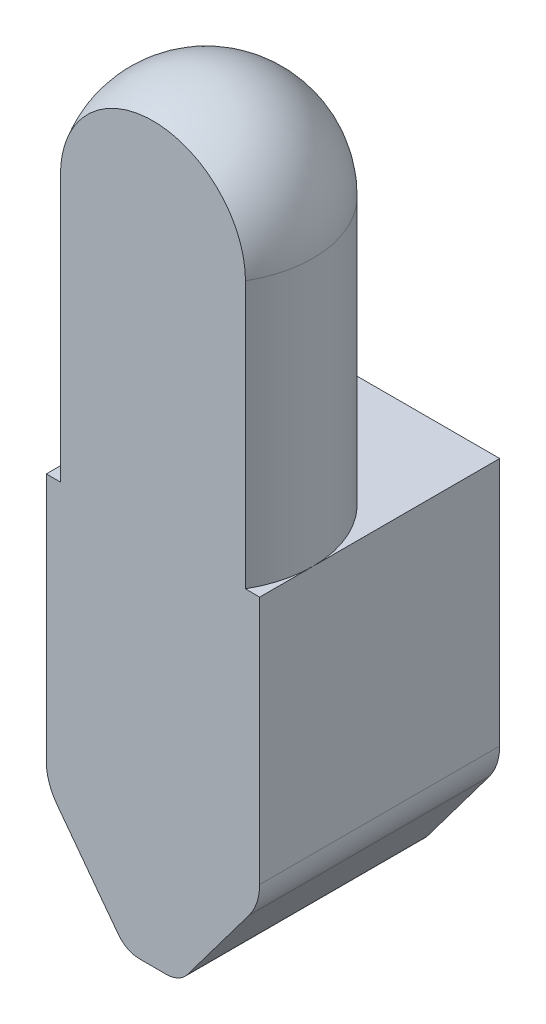
from build123d import *

# Parameters (mm, degrees)
EXTRUDE_1_DEPTH          = 4.5
EXTRUDE_2_DEPTH          = 5
CUT_EXTRUDE_1_DEPTH      = 13.971121771
CUT_EXTRUDE_1_DEPTH_BACK = 13.971121771
SKETCH_4_W               = 4.107505073
SKETCH_4_H               = 2.274071006
FILLET_1_R               = 1
FILLET_2_R               = 0.5


with BuildPart() as part:
    # Эскиз1 → Бобышка-Вытянуть1 (new body)
    with BuildSketch(Plane.XY):
        Polygon((2, 0), (2, 5), (-2, 5), (-2, 0), (-0.5, -2), (0.5, -2), align=None)
    extrude(amount=-EXTRUDE_1_DEPTH)

    # Эскиз2 → Бобышка-Вытянуть2 (add)
    with BuildSketch(Plane(origin=(0, 5, 0), x_dir=(1, 0, 0), z_dir=(0, 1, 0))):
        with BuildLine():
            Line((-1.732050808, 0), (1.732050808, 0))
            ThreePointArc((1.732050808, 0), (0, 3), (-1.732050808, 0))
        make_face()
    extrude(amount=EXTRUDE_2_DEPTH)

    # Эскиз3 → Повернуть1 (revolve)
    with BuildSketch(Plane(origin=(0, 10, 0), x_dir=(1, 0, 0), z_dir=(0, 1, 0))):
        with BuildLine():
            ThreePointArc((2, 1), (0, 3), (-2, 1))
            Line((-2, 1), (2, 1))
        make_face()
    revolve(axis=Axis((-2, 10, -1), (1, 0, 0)))

    # Эскиз4 → Вырез-Вытянуть1 (cut, two sides: drawn at the far end of the back side and taken through both)
    with BuildSketch(Plane(origin=(0, 0, 0), x_dir=(1, 0, 0), z_dir=(0, 1, 0)).offset(-CUT_EXTRUDE_1_DEPTH_BACK)):
        with Locations((0.053752537, -1.137035503)):
            Rectangle(SKETCH_4_W, SKETCH_4_H)
    extrude(amount=CUT_EXTRUDE_1_DEPTH + CUT_EXTRUDE_1_DEPTH_BACK, mode=Mode.SUBTRACT)

    # Скругление1
    fillet_1_edges = [part.edges().sort_by_distance(p)[0] for p in [
        (-2, 0, -2.25),
        (2, 0, -2.25),
    ]]
    fillet(fillet_1_edges, radius=FILLET_1_R)

    # Скругление2
    fillet_2_edges = [part.edges().sort_by_distance(p)[0] for p in [
        (-0.5, -2, -2.25),
        (0.5, -2, -2.25),
    ]]
    fillet(fillet_2_edges, radius=FILLET_2_R)


solid = part.part
